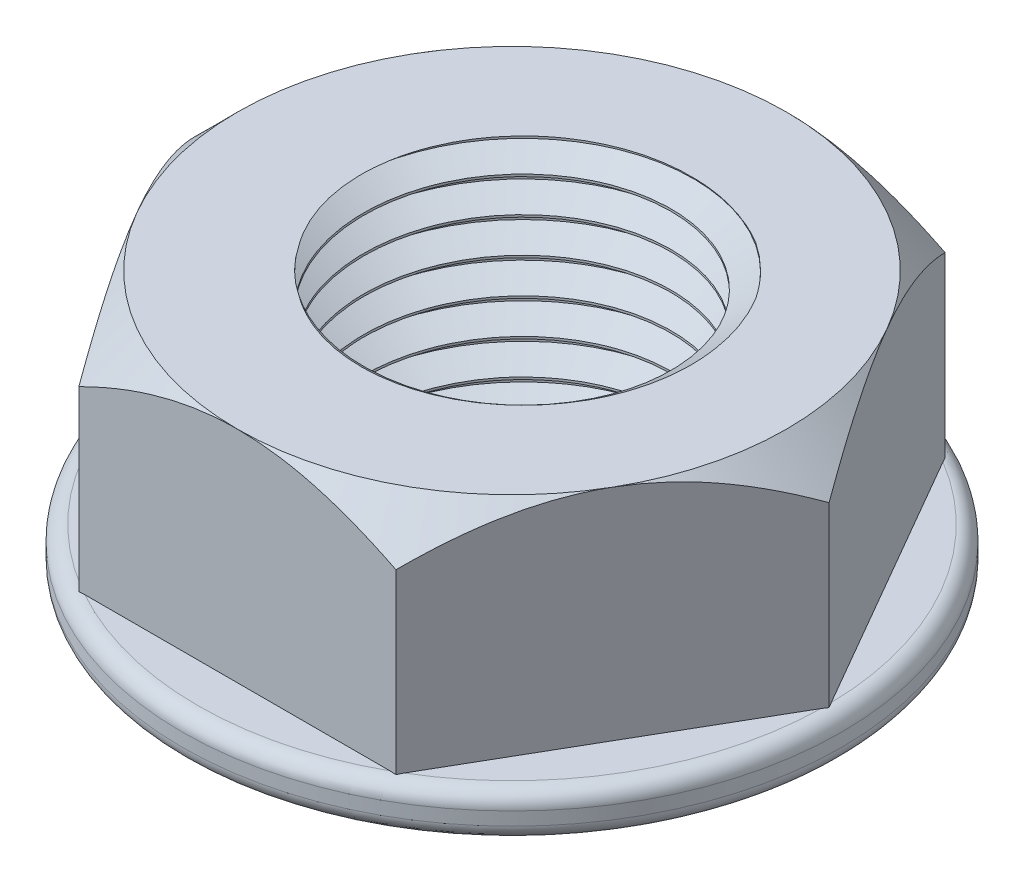
from build123d import *

# Parameters (mm, degrees)
BOSS_EXTRUDE1_DEPTH = 10
SKETCH2_OUTSIDE_W   = 58.764
SKETCH2_OUTSIDE_H   = 54.896
SKETCH2_OUTSIDE_R   = 12.5
CUT_EXTRUDE1_DEPTH  = 10
CUT_EXTRUDE1_DRAFT  = -45
SKETCH3_R           = 15
BOSS_EXTRUDE2_DEPTH = 2
FILLET4_R           = 0.7
FILLET5_R           = 0.7
SKETCH4_R           = 7
CUT_EXTRUDE2_DEPTH  = 15
CUT_SWEEP1_PITCH    = 1.6


with BuildPart() as part:
    # Sketch1 → Boss-Extrude1 (new body)
    with BuildSketch(Plane(origin=(0, 0, 0), x_dir=(1, 0, 0), z_dir=(0, 1, 0))):
        Polygon((14.43375673, 0), (7.216878365, 12.5), (-7.216878365, 12.5), (-14.43375673, 0), (-7.216878365, -12.5), (7.216878365, -12.5), align=None)
    extrude(amount=BOSS_EXTRUDE1_DEPTH)


with BuildPart() as cut_extrude1_tool:
    # Sketch2 outside → Cut-Extrude1 (with draft: the straight prism first)
    with BuildSketch(Plane(origin=(0, 10, 0), x_dir=(1, 0, 0), z_dir=(0, 1, 0))):
        Rectangle(SKETCH2_OUTSIDE_W, SKETCH2_OUTSIDE_H)
        Circle(SKETCH2_OUTSIDE_R, mode=Mode.SUBTRACT)
    extrude(amount=-CUT_EXTRUDE1_DEPTH)
    # Cut-Extrude1: the draft: its side faces are tilted about the plane it starts from
    cut_extrude1_sides = [cut_extrude1_tool.faces().sort_by_distance(p)[0] for p in [
        (0, 5, 27.448),
        (29.382, 5, 0),
        (0, 5, -27.448),
        (-29.382, 5, 0),
        (-12.5, 5, 0),
    ]]
    draft(cut_extrude1_sides, Plane(origin=(0, 10, 0), x_dir=(1, 0, 0), z_dir=(0, 1, 0)), CUT_EXTRUDE1_DRAFT)


with BuildPart() as part_1:
    add(part.part)

    # Cut-Extrude1: cut by cut_extrude1_tool
    add(cut_extrude1_tool.part, mode=Mode.SUBTRACT)

    # Sketch3 → Boss-Extrude2 (add)
    with BuildSketch(Plane.XZ):
        with Locations(Location((0, 0, 0), (0, 0, 270))):
            Circle(SKETCH3_R)
    extrude(amount=BOSS_EXTRUDE2_DEPTH)

    # Fillet4
    fillet4_edges = [part_1.edges().sort_by_distance(p)[0] for p in [
        (0, -2, 15),
    ]]
    fillet(fillet4_edges, radius=FILLET4_R)

    # Fillet5
    # the kernel refuses this fillet: 0.7 mm, written as the material it takes off along each edge
    with BuildSketch(Plane(origin=(0, 0, 0), x_dir=(0, 0, -1), z_dir=(-1, 0, 0))) as fillet5_piece_1_section:
        with BuildLine():
            CenterArc((15 - FILLET5_R, FILLET5_R), FILLET5_R, 270, 90)
            Line((15 - FILLET5_R, 0), (15, 0))
            Line((15, 0), (15, FILLET5_R))
        make_face()
    fillet5_piece_1 = revolve(axis=Axis((0, 0, 0), (0, -1, 0)), mode=Mode.PRIVATE)
    fillet5_piece_1 = split(fillet5_piece_1, bisect_by=Plane(origin=(0, 0, -12.5), z_dir=(0, 0, -1)), keep=Keep.TOP, mode=Mode.PRIVATE)
    add(fillet5_piece_1, mode=Mode.SUBTRACT)
    with BuildSketch(Plane(origin=(0, 0, 0), x_dir=(0, 0, -1), z_dir=(-1, 0, 0))) as fillet5_piece_2_section:
        with BuildLine():
            CenterArc((15 - FILLET5_R, FILLET5_R), FILLET5_R, 270, 90)
            Line((15 - FILLET5_R, 0), (15, 0))
            Line((15, 0), (15, FILLET5_R))
        make_face()
    fillet5_piece_2 = revolve(axis=Axis((0, 0, 0), (0, -1, 0)), mode=Mode.PRIVATE)
    fillet5_piece_2 = split(fillet5_piece_2, bisect_by=Plane(origin=(10.825317547, 0, -6.25), z_dir=(0.8660254037844382, 0, -0.500000000000001)), keep=Keep.TOP, mode=Mode.PRIVATE)
    add(fillet5_piece_2, mode=Mode.SUBTRACT)
    with BuildSketch(Plane(origin=(0, 0, 0), x_dir=(0, 0, -1), z_dir=(-1, 0, 0))) as fillet5_piece_3_section:
        with BuildLine():
            CenterArc((15 - FILLET5_R, FILLET5_R), FILLET5_R, 270, 90)
            Line((15 - FILLET5_R, 0), (15, 0))
            Line((15, 0), (15, FILLET5_R))
        make_face()
    fillet5_piece_3 = revolve(axis=Axis((0, 0, 0), (0, -1, 0)), mode=Mode.PRIVATE)
    fillet5_piece_3 = split(fillet5_piece_3, bisect_by=Plane(origin=(-10.825317547, 0, -6.25), z_dir=(-0.8660254037844416, 0, -0.4999999999999949)), keep=Keep.TOP, mode=Mode.PRIVATE)
    add(fillet5_piece_3, mode=Mode.SUBTRACT)
    with BuildSketch(Plane(origin=(0, 0, 0), x_dir=(0, 0, -1), z_dir=(-1, 0, 0))) as fillet5_piece_4_section:
        with BuildLine():
            CenterArc((15 - FILLET5_R, FILLET5_R), FILLET5_R, 270, 90)
            Line((15 - FILLET5_R, 0), (15, 0))
            Line((15, 0), (15, FILLET5_R))
        make_face()
    fillet5_piece_4 = revolve(axis=Axis((0, 0, 0), (0, -1, 0)), mode=Mode.PRIVATE)
    fillet5_piece_4 = split(fillet5_piece_4, bisect_by=Plane(origin=(10.825317547, 0, 6.25), z_dir=(0.8660254037844416, 0, 0.4999999999999949)), keep=Keep.TOP, mode=Mode.PRIVATE)
    add(fillet5_piece_4, mode=Mode.SUBTRACT)
    with BuildSketch(Plane(origin=(0, 0, 0), x_dir=(0, 0, -1), z_dir=(-1, 0, 0))) as fillet5_piece_5_section:
        with BuildLine():
            CenterArc((15 - FILLET5_R, FILLET5_R), FILLET5_R, 270, 90)
            Line((15 - FILLET5_R, 0), (15, 0))
            Line((15, 0), (15, FILLET5_R))
        make_face()
    fillet5_piece_5 = revolve(axis=Axis((0, 0, 0), (0, -1, 0)), mode=Mode.PRIVATE)
    fillet5_piece_5 = split(fillet5_piece_5, bisect_by=Plane(origin=(-10.825317547, 0, 6.25), z_dir=(-0.8660254037844346, 0, 0.500000000000007)), keep=Keep.TOP, mode=Mode.PRIVATE)
    add(fillet5_piece_5, mode=Mode.SUBTRACT)
    with BuildSketch(Plane(origin=(0, 0, 0), x_dir=(0, 0, -1), z_dir=(-1, 0, 0))) as fillet5_piece_6_section:
        with BuildLine():
            CenterArc((15 - FILLET5_R, FILLET5_R), FILLET5_R, 270, 90)
            Line((15 - FILLET5_R, 0), (15, 0))
            Line((15, 0), (15, FILLET5_R))
        make_face()
    fillet5_piece_6 = revolve(axis=Axis((0, 0, 0), (0, -1, 0)), mode=Mode.PRIVATE)
    fillet5_piece_6 = split(fillet5_piece_6, bisect_by=Plane(origin=(0, 0, 12.5), z_dir=(0, 0, 1)), keep=Keep.TOP, mode=Mode.PRIVATE)
    add(fillet5_piece_6, mode=Mode.SUBTRACT)

    # Sketch4 → Cut-Extrude2 (cut)
    with BuildSketch(Plane.XZ.offset(2)):
        with Locations(Location((0, 0, 0), (0, 0, 270))):
            Circle(SKETCH4_R)
    extrude(amount=-CUT_EXTRUDE2_DEPTH, mode=Mode.SUBTRACT)

    # Cut-Sweep1: arcs per turn and ends read off the stored shape
    # Cut-Sweep1: the profile of Sketch7 profile screwed along a left-hand helix through 12.5 turns, 8 arcs to a turn; built about Z, then put on its axis
    cut_sweep1_z = Axis((0, 0, 0), (0, 0, 1))
    cut_sweep1_corners = [(6.9997, 0, 0.750210009), (6.9997, 0, -0.750209991), (8, 0, -0.049999991), (8, 0, 0.050000009)]
    with BuildLine(mode=Mode.PRIVATE) as cut_sweep1_profile:
        Line(cut_sweep1_corners[0], cut_sweep1_corners[1])
        Line(cut_sweep1_corners[1], cut_sweep1_corners[2])
        Line(cut_sweep1_corners[2], cut_sweep1_corners[3])
        Line(cut_sweep1_corners[3], cut_sweep1_corners[0])
    cut_sweep1_cap = Face(cut_sweep1_profile.wire())
    cut_sweep1_turn_angles = [0, -22.5, -45, -67.5, -90, -112.5, -135, -157.5, -180, -202.5, -225, -247.5, -270, -292.5, -315, -337.5, -360]
    cut_sweep1_turn_weights = [1, 0.9238795325112867, 1, 0.9238795325112867, 1, 0.9238795325112867, 1, 0.9238795325112867, 1, 0.9238795325112867, 1, 0.9238795325112867, 1, 0.9238795325112867, 1, 0.9238795325112867, 1]
    cut_sweep1_turn_rails = [Edge.make_bspline([Vector(p[0], p[1], 0).rotate(cut_sweep1_z, cut_sweep1_turn_angles[k]) / cut_sweep1_turn_weights[k] + Vector(0, 0, p[2] + -CUT_SWEEP1_PITCH * cut_sweep1_turn_angles[k] / 360) for k in range(17)], [0, 0, 0, 1, 1, 2, 2, 3, 3, 4, 4, 5, 5, 6, 6, 7, 7, 8, 8, 8], 2, cut_sweep1_turn_weights) for p in cut_sweep1_corners]
    cut_sweep1_turn_sides = [Face.make_surface_from_curves(cut_sweep1_turn_rails[p[0]], cut_sweep1_turn_rails[p[1]]) for p in [(0, 1), (1, 2), (2, 3), (3, 0)]]
    cut_sweep1_last_angles = [-4320, -4342.5, -4365, -4387.5, -4410, -4432.5, -4455, -4477.5, -4500]
    cut_sweep1_last_weights = [1, 0.9238795325112867, 1, 0.9238795325112867, 1, 0.9238795325112867, 1, 0.9238795325111957, 1]
    cut_sweep1_last_rails = [Edge.make_bspline([Vector(p[0], p[1], 0).rotate(cut_sweep1_z, cut_sweep1_last_angles[k]) / cut_sweep1_last_weights[k] + Vector(0, 0, p[2] + -CUT_SWEEP1_PITCH * cut_sweep1_last_angles[k] / 360) for k in range(9)], [0, 0, 0, 1, 1, 2, 2, 3, 3, 4, 4, 4], 2, cut_sweep1_last_weights) for p in cut_sweep1_corners]
    cut_sweep1_last_sides = [Face.make_surface_from_curves(cut_sweep1_last_rails[p[0]], cut_sweep1_last_rails[p[1]]) for p in [(0, 1), (1, 2), (2, 3), (3, 0)]]
    cut_sweep1 = Plane(origin=(0, -5, 0), x_dir=(-1, 0, 0), z_dir=(0, 1, 0)) * Solid(Shell([*[p.moved(Location((0, 0, CUT_SWEEP1_PITCH * i))) for i in range(12) for p in cut_sweep1_turn_sides], *cut_sweep1_last_sides, cut_sweep1_cap, cut_sweep1_cap.rotate(cut_sweep1_z, -4500).moved(Location((0, 0, -CUT_SWEEP1_PITCH * -4500 / 360)))]))
    add(cut_sweep1, mode=Mode.SUBTRACT)


solid = part_1.part
